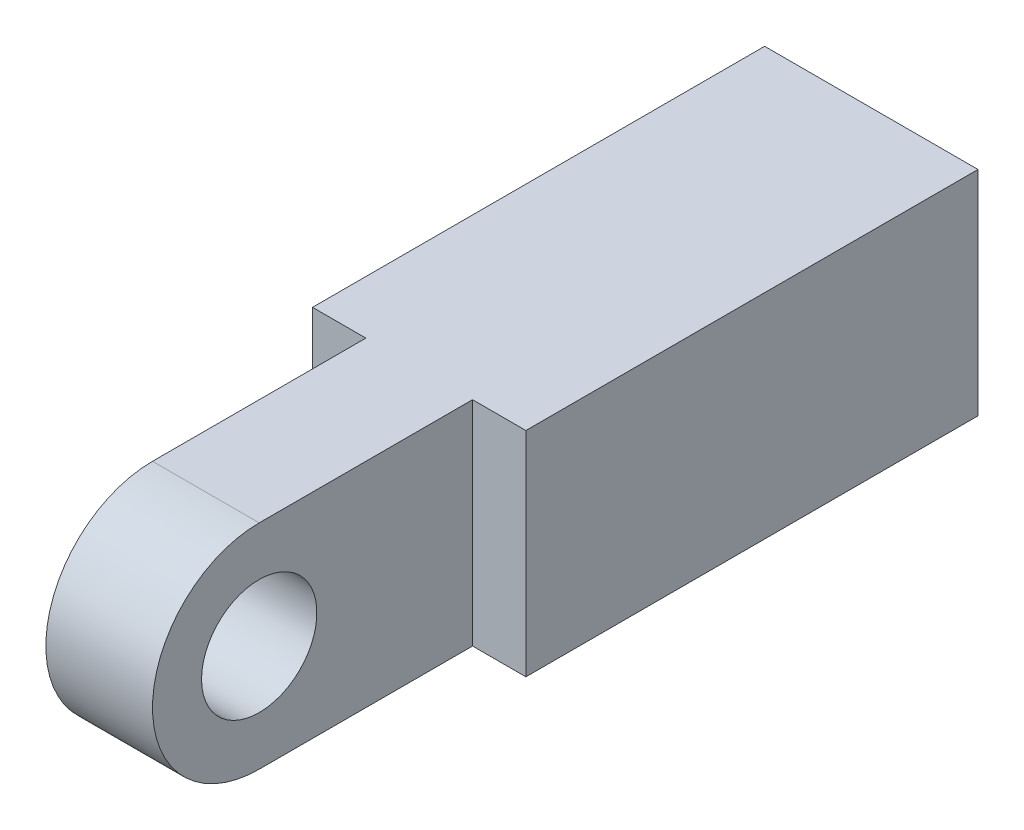
from build123d import *

# Parameters (mm, degrees)
SKETCH2_W           = 42
SKETCH2_H           = 42
BOSS_EXTRUDE1_DEPTH = 89
SKETCH7_W           = 32
SKETCH7_H           = 32
CUT_EXTRUDE1_DEPTH  = 81
SKETCH3_W           = 21
SKETCH3_H           = 42
BOSS_EXTRUDE2_DEPTH = 42
BOSS_EXTRUDE3_DEPTH = 21
SKETCH9_R           = 11.35
CUT_EXTRUDE2_DEPTH  = 157.643703991


with BuildPart() as part:
    # Sketch2 → Boss-Extrude1 (new body)
    with BuildSketch(Plane.XY):
        Rectangle(SKETCH2_W, SKETCH2_H)
    extrude(amount=BOSS_EXTRUDE1_DEPTH)

    # Sketch7 → Cut-Extrude1 (cut)
    with BuildSketch(Plane(origin=(0, 0, 0), x_dir=(-1, 0, 0), z_dir=(0, 0, -1))):
        Rectangle(SKETCH7_W, SKETCH7_H)
    extrude(amount=-CUT_EXTRUDE1_DEPTH, mode=Mode.SUBTRACT)

    # Sketch3 → Boss-Extrude2 (add)
    with BuildSketch(Plane.XY.offset(89)):
        Rectangle(SKETCH3_W, SKETCH3_H)
    extrude(amount=BOSS_EXTRUDE2_DEPTH)

    # Sketch8 → Boss-Extrude3 (add)
    with BuildSketch(Plane.ZY.offset(10.5)):
        with BuildLine():
            Line((131, 21), (131, -21))
            ThreePointArc((131, -21), (152, 0), (131, 21))
        make_face()
    extrude(amount=-BOSS_EXTRUDE3_DEPTH)

    # Sketch9 → Cut-Extrude2 (cut, through all)
    with BuildSketch(Plane.ZY.offset(10.5)):
        with Locations((131, 0)):
            Circle(SKETCH9_R)
    extrude(amount=-CUT_EXTRUDE2_DEPTH, mode=Mode.SUBTRACT)


solid = part.part
